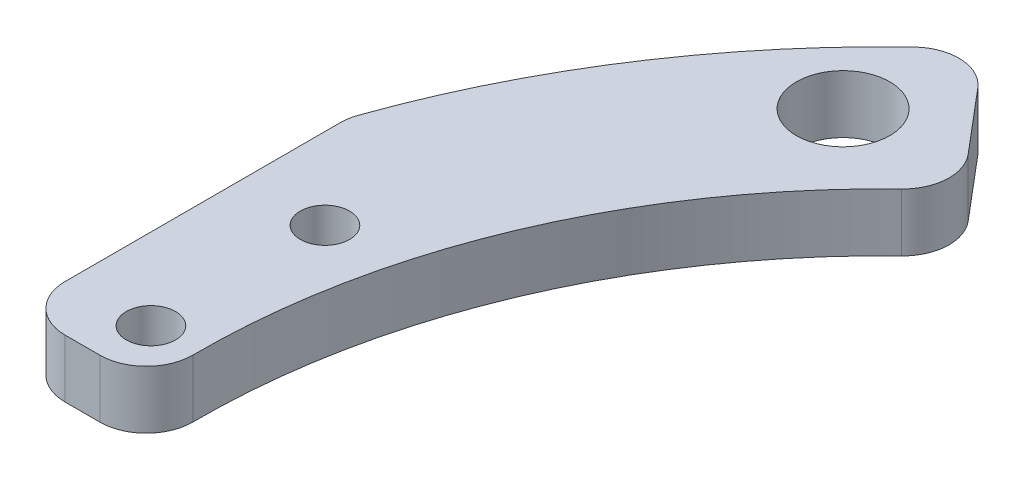
from build123d import *

# Parameters (mm, degrees)
SKETCH1_R               = 4.025
SKETCH1_R_2             = 2.125
BOSS_EXTRUDE1_DEPTH     = 5
CUT_EXTRUDE1_DEPTH      = 94.253609554
CUT_EXTRUDE1_DEPTH_BACK = 94.253609554
SKETCH2_W               = 28.904595792
SKETCH2_H               = 55.332112
CUT_EXTRUDE2_DEPTH      = 91.112350401
CUT_EXTRUDE2_DEPTH_BACK = 91.112350401
SKETCH3_W               = 24.207106467
SKETCH3_H               = 21.100530829
FILLET1_R               = 4


with BuildPart() as part:
    # Sketch1 → Boss-Extrude1 (new body)
    with BuildSketch(Plane(origin=(0, 0, 0), x_dir=(1, 0, 0), z_dir=(0, 1, 0))):
        with BuildLine():
            Line((-47.75734818, 56.526415903), (-38.07680463, 45.068358625))
            ThreePointArc((-38.07680463, 45.068358625), (-56.716415256, 16.255714087), (-56.169167779, -18.056151058))
            Line((-56.169167779, -18.056151058), (-70.449464672, -22.646697938))
            ThreePointArc((-70.449464672, -22.646697938), (-71.135842864, 20.388522754), (-47.75734818, 56.526415903))
        make_face()
        with Locations((-49.366374859, 46.034889304)):
            Circle(SKETCH1_R, mode=Mode.SUBTRACT)
        with Locations((-63, 0)):
            Circle(SKETCH1_R_2, mode=Mode.SUBTRACT)
        with Locations((-63, -15)):
            Circle(SKETCH1_R_2, mode=Mode.SUBTRACT)
        with Locations((-63, 15)):
            Circle(SKETCH1_R_2, mode=Mode.SUBTRACT)
    extrude(amount=BOSS_EXTRUDE1_DEPTH)

    # Sketch2 → Cut-Extrude1 (cut, two sides: drawn at the far end of the back side and taken through both)
    with BuildSketch(Plane(origin=(0, 5, 0), x_dir=(1, 0, 0), z_dir=(0, 1, 0)).offset(-CUT_EXTRUDE1_DEPTH_BACK)):
        with Locations((-84.452297896, 0)):
            Rectangle(SKETCH2_W, SKETCH2_H)
    extrude(amount=CUT_EXTRUDE1_DEPTH + CUT_EXTRUDE1_DEPTH_BACK, mode=Mode.SUBTRACT)

    # Sketch3 → Cut-Extrude2 (cut, two sides: drawn at the far end of the back side and taken through both)
    with BuildSketch(Plane(origin=(0, 5, 0), x_dir=(1, 0, 0), z_dir=(0, 1, 0)).offset(-CUT_EXTRUDE2_DEPTH_BACK)):
        with Locations((-57.896446767, -14.949043558)):
            Rectangle(SKETCH3_W, SKETCH3_H)
    extrude(amount=CUT_EXTRUDE2_DEPTH + CUT_EXTRUDE2_DEPTH_BACK, mode=Mode.SUBTRACT)

    # Fillet1
    fillet1_edges = [part.edges().sort_by_distance(p)[0] for p in [
        (-70, 2.5, -24),
        (-70, 2.5, 4.398778143),
        (-58.835794809, 2.5, 4.398778143),
        (-38.07680463, 2.5, -45.068358625),
        (-47.75734818, 2.5, -56.526415903),
    ]]
    fillet(fillet1_edges, radius=FILLET1_R)


solid = part.part
